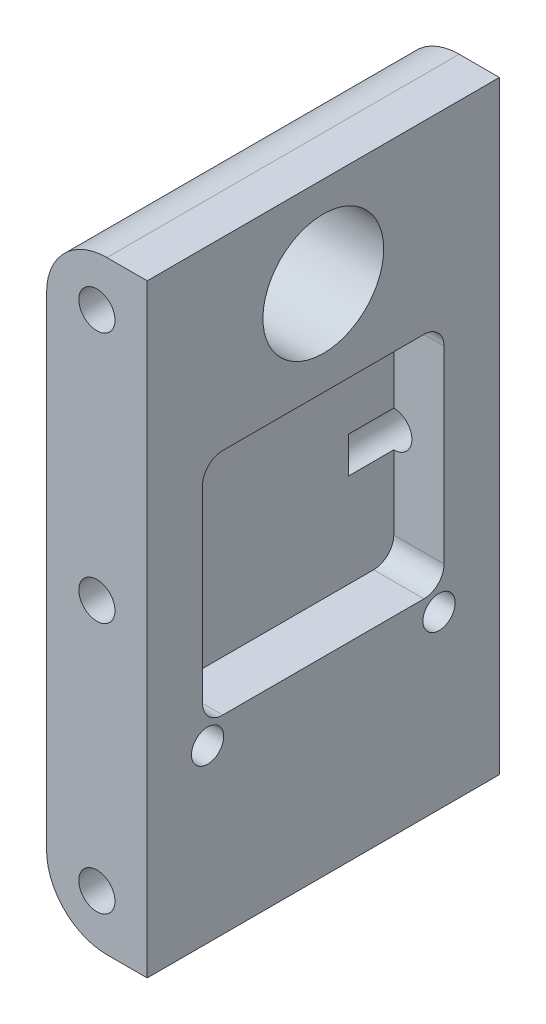
from build123d import *

# Parameters (mm, degrees)
SKETCH1_W           = 35
SKETCH1_H           = 60
SKETCH1_R           = 6
SKETCH1_R_2         = 1.6
BOSS_EXTRUDE1_DEPTH = 10
SKETCH2_R           = 1.8
CUT_EXTRUDE1_DEPTH  = 10
CUT_EXTRUDE2_START  = -10
SKETCH3_R           = 1.8
CUT_EXTRUDE2_DEPTH  = 10
CUT_EXTRUDE3_DEPTH  = 5
FILLET1_R           = 6


with BuildPart() as part:
    # Sketch1 → Boss-Extrude1 (new body)
    with BuildSketch(Plane(origin=(0, 0, 0), x_dir=(0, 0, -1), z_dir=(1, 0, 0))):
        with Locations((17.5, 30)):
            Rectangle(SKETCH1_W, SKETCH1_H)
        with Locations((17.5, 51)):
            Circle(SKETCH1_R, mode=Mode.SUBTRACT)
        with Locations((6, 17)):
            Circle(SKETCH1_R_2, mode=Mode.SUBTRACT)
        with Locations((29, 17)):
            Circle(SKETCH1_R_2, mode=Mode.SUBTRACT)
    extrude(amount=BOSS_EXTRUDE1_DEPTH)

    # Sketch2 → Cut-Extrude1 (cut)
    with BuildSketch(Plane(origin=(0, 0, -35), x_dir=(-1, 0, 0), z_dir=(0, 0, -1))):
        with Locations((-5, 55)):
            Circle(SKETCH2_R)
        with Locations((-5, 30)):
            Circle(SKETCH2_R)
        with Locations((-5, 5)):
            Circle(SKETCH2_R)
    extrude(amount=-CUT_EXTRUDE1_DEPTH, mode=Mode.SUBTRACT)

    # Sketch3 → Cut-Extrude2 (cut)
    with BuildSketch(Plane.XY.offset(CUT_EXTRUDE2_START)):
        with Locations(Location((5, 55, 0), (0, 0, 180))):
            Circle(SKETCH3_R)
        with Locations(Location((5, 30, 0), (0, 0, 180))):
            Circle(SKETCH3_R)
        with Locations(Location((5, 5, 0), (0, 0, 180))):
            Circle(SKETCH3_R)
    extrude(amount=CUT_EXTRUDE2_DEPTH, mode=Mode.SUBTRACT)

    # Sketch4 → Cut-Extrude3 (cut)
    with BuildSketch(Plane(origin=(10, 0, 0), x_dir=(0, 0, -1), z_dir=(1, 0, 0))):
        with BuildLine():
            Line((29.5, 31.881008272), (29.5, 20.881008272))
            ThreePointArc((29.5, 20.881008272), (28.914213562, 19.466794709), (27.5, 18.881008272))
            Line((27.5, 18.881008272), (7.5, 18.881008272))
            ThreePointArc((7.5, 18.881008272), (6.085786438, 19.466794709), (5.5, 20.881008272))
            Line((5.5, 20.881008272), (5.5, 31.881008272))
            Line((5.5, 31.881008272), (5.5, 36.640158011))
            Line((5.5, 36.640158011), (5.5, 39.640158011))
            ThreePointArc((5.5, 39.640158011), (6.085786438, 41.054371573), (7.5, 41.640158011))
            Line((7.5, 41.640158011), (27.5, 41.640158011))
            ThreePointArc((27.5, 41.640158011), (28.914213562, 41.054371573), (29.5, 39.640158011))
            Line((29.5, 39.640158011), (29.5, 36.640158011))
            Line((29.5, 36.640158011), (29.5, 31.881008272))
        make_face()
    extrude(amount=-CUT_EXTRUDE3_DEPTH, mode=Mode.SUBTRACT)

    # Fillet1
    # the kernel refuses this fillet: 6 mm, written as the material it takes off along each edge
    with BuildSketch(Plane(origin=(0, 60, -50), x_dir=(0, -1, 0), z_dir=(0, 0, 1))) as fillet1_piece_1:
        with BuildLine():
            CenterArc((FILLET1_R, FILLET1_R), FILLET1_R, 180, 90)
            Line((0, FILLET1_R), (0, 0))
            Line((0, 0), (FILLET1_R, 0))
        make_face()
    extrude(amount=65, mode=Mode.SUBTRACT)
    with BuildSketch(Plane(origin=(0, 0, 15), x_dir=(1, 0, 0), z_dir=(0, 0, -1))) as fillet1_piece_2:
        with BuildLine():
            CenterArc((FILLET1_R, -FILLET1_R), FILLET1_R, 90, 90)
            Line((0, -FILLET1_R), (0, 0))
            Line((0, 0), (FILLET1_R, 0))
        make_face()
    extrude(amount=65, mode=Mode.SUBTRACT)


solid = part.part
